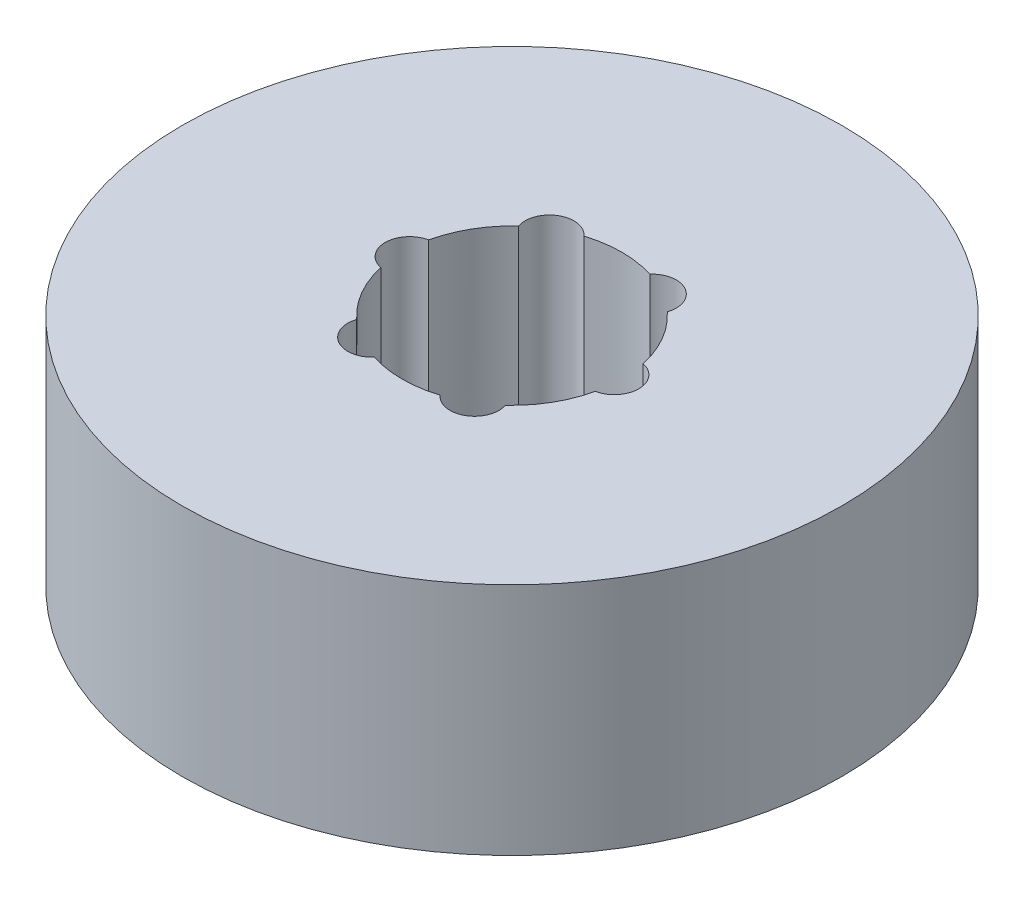
from build123d import *

# Parameters (mm, degrees)
SKETCH1_R           = 22.5
BOSS_EXTRUDE1_DEPTH = 16
SKETCH2_R           = 7.5
CUT_EXTRUDE1_DEPTH  = 36.616007637
SKETCH3_R           = 1.667631155
CUT_EXTRUDE2_DEPTH  = 15.744592973
CIRPATTERN1_COUNT   = 6


with BuildPart() as part:
    # Sketch1 → Boss-Extrude1 (new body)
    with BuildSketch(Plane(origin=(0, 0, 0), x_dir=(1, 0, 0), z_dir=(0, 1, 0))):
        Circle(SKETCH1_R)
    extrude(amount=BOSS_EXTRUDE1_DEPTH)

    # Sketch2 → Cut-Extrude1 (cut, through all)
    with BuildSketch(Plane(origin=(0, 0, 0), x_dir=(1, 0, 0), z_dir=(0, 1, 0))):
        Circle(SKETCH2_R)
    extrude(amount=CUT_EXTRUDE1_DEPTH, mode=Mode.SUBTRACT)

    # Sketch3 → Cut-Extrude2 (cut)
    with BuildSketch(Plane(origin=(0, 16, 0), x_dir=(1, 0, 0), z_dir=(0, 1, 0))):
        with Locations((-6.984974331, 0)):
            Circle(SKETCH3_R)
    cut_extrude2 = extrude(amount=-CUT_EXTRUDE2_DEPTH, mode=Mode.SUBTRACT)

    # CirPattern1: Cut-Extrude2 ×6 about axis
    cirpattern1_axis = Axis((0, 0, 0), (0, 1, 0))
    for i in range(1, CIRPATTERN1_COUNT):
        add(cut_extrude2.rotate(cirpattern1_axis, i * 360 / CIRPATTERN1_COUNT), mode=Mode.SUBTRACT)


solid = part.part
